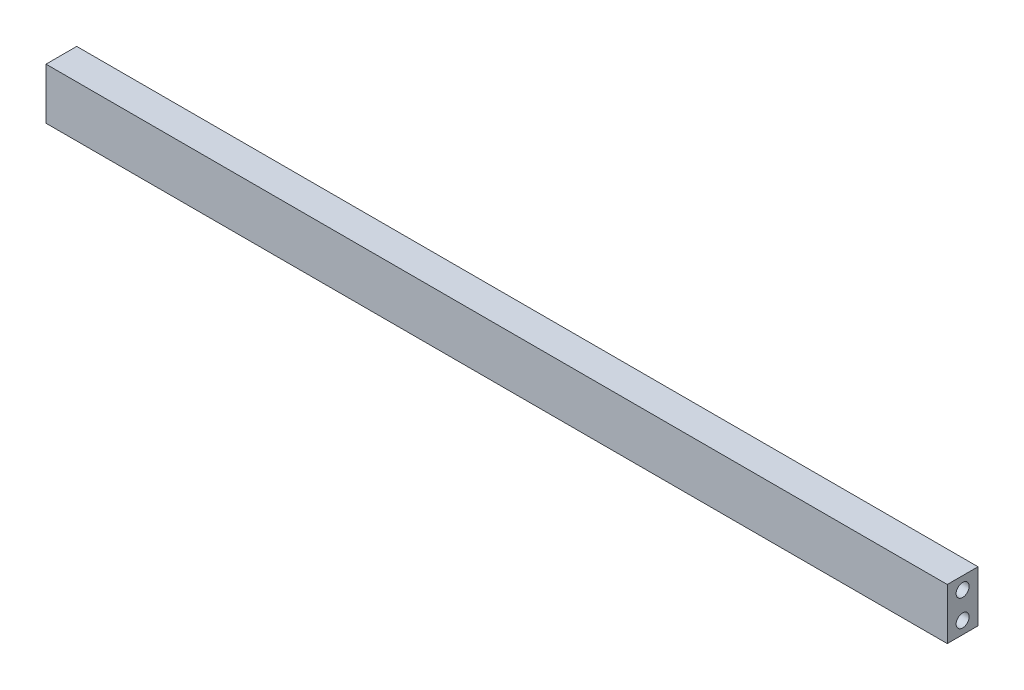
from build123d import *

# Parameters (mm, degrees)
SKETCH1_W                           = 9.525
SKETCH1_H                           = 15.875
BOSS_EXTRUDE1_DEPTH                 = 139.7
TAP_DRILL_FOR_10_32_TAP1_AT_2_COUNT = 2
TAP_DRILL_FOR_10_32_TAP1_AT_2_PITCH = 8.1788


with BuildPart() as part:
    # Sketch1 → Boss-Extrude1 (new, symmetric)
    with BuildSketch(Plane(origin=(0, 0, 0), x_dir=(0, 0, -1), z_dir=(1, 0, 0))):
        Rectangle(SKETCH1_W, SKETCH1_H)
    extrude(amount=BOSS_EXTRUDE1_DEPTH, both=True)

    # Sketch4 → Tap Drill for #10-32 Tap1 (revolve, cut)
    with BuildSketch(Plane(origin=(139.7, 4.0894, 0), x_dir=(0, 0, -1), z_dir=(0, 1, 0))):
        Polygon((0, 0), (0, 11.373317848), (2.0193, 10.16), (2.0193, 0), align=None)
    tap_drill_for_10_32_tap1 = revolve(axis=Axis((146.05, 4.0894, 0), (-1, 0, 0)), mode=Mode.SUBTRACT)

    # Tap Drill for #10-32 Tap1 at 2: Tap Drill for #10-32 Tap1 ×2
    with Locations(*[(0, -i * TAP_DRILL_FOR_10_32_TAP1_AT_2_PITCH, 0) for i in range(1, TAP_DRILL_FOR_10_32_TAP1_AT_2_COUNT)]):
        add(tap_drill_for_10_32_tap1, mode=Mode.SUBTRACT)

    # Mirror1: Tap Drill for #10-32 Tap1 across plane
    add(tap_drill_for_10_32_tap1.mirror(Plane(origin=(0, 0, 0), x_dir=(0, 0, 1), z_dir=(1, 0, 0))), mode=Mode.SUBTRACT)

    # Mirror1 copy 1 sketch → Mirror1 copy 1 (revolve, cut)
    with BuildSketch(Plane(origin=(-139.7, -4.0894, 0), x_dir=(0, 0, -1), z_dir=(0, 1, 0))):
        Polygon((0, 0), (0, -11.373317848), (2.0193, -10.16), (2.0193, 0), align=None)
    revolve(axis=Axis((-146.05, -4.0894, 0), (-1, 0, 0)), mode=Mode.SUBTRACT)


solid = part.part
